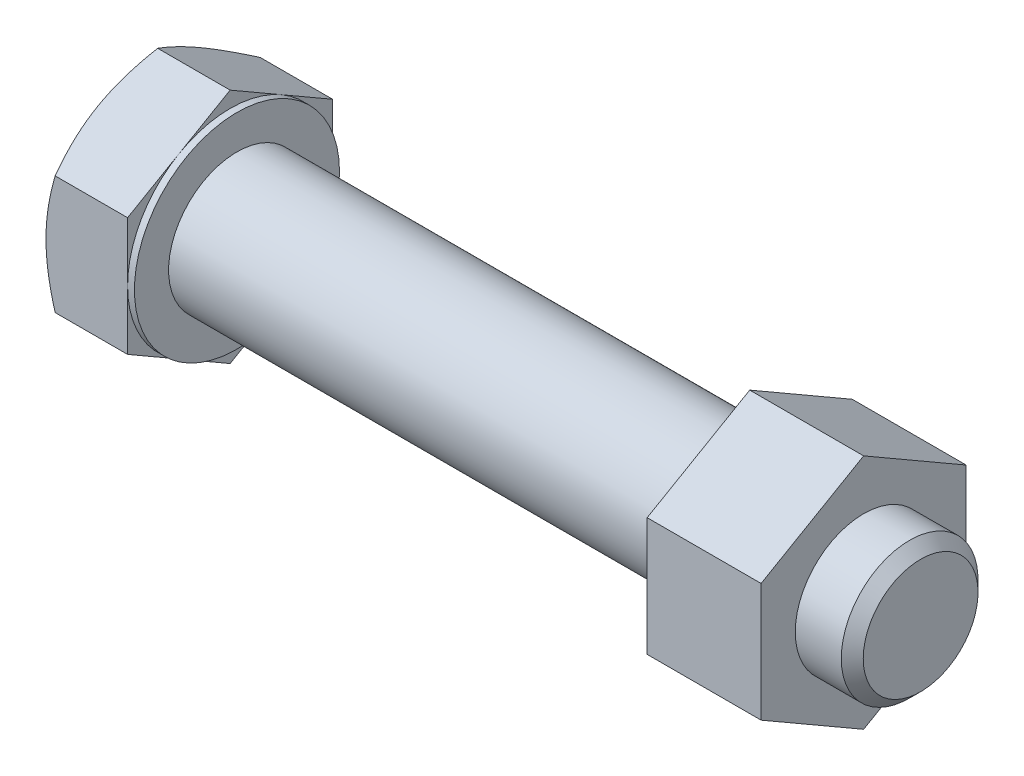
from build123d import *

# Parameters (mm, degrees)
BASEHEAD_DEPTH      = 7.76
SKETCH4_W           = 0.6
SKETCH4_H           = 11.392304845
BOSS_EXTRUDE1_DEPTH = 10


# Read off the part's stored shape, not the designer's step: HeadChamfer
with BuildPart() as part:
    # Sketch1 → BaseHead (new body)
    with BuildSketch(Plane(origin=(0, 0, 0), x_dir=(0, 0, -1), z_dir=(1, 0, 0))):
        Polygon((9, 5.196152423), (9, -5.196152423), (0, -10.392304845), (-9, -5.196152423), (-9, 5.196152423), (0, 10.392304845), align=None)
    extrude(amount=BASEHEAD_DEPTH)

    # HeadChamfer outline → HeadChamfer (revolve, cut)
    with BuildSketch(Plane.YX):
        Polygon((10.392304847, 0.803847578), (9, 0), (10.392304847, 0), align=None)
    revolve(axis=Axis((0, 0, 0), (1, 0, 0)), mode=Mode.SUBTRACT)

    # HeadChamfer 2 outline → HeadChamfer 2 (revolve)
    with BuildSketch(Plane.YX):
        Polygon((6, 7.76), (6, 66.796), (5.036, 67.76), (0, 67.76), (0, 7.76), align=None)
    revolve(axis=Axis((0, 0, 0), (1, 0, 0)))

    # Sketch4 → BearingFace (revolve, cut)
    with BuildSketch(Plane.XY, mode=Mode.PRIVATE) as bearingface_sk:
        with Locations((7.46, 14.696152423)):
            Rectangle(SKETCH4_W, SKETCH4_H)
    revolve(bearingface_sk.sketch.rotate(Axis((0, 0, 0), (1, 0, 0)), 90), axis=Axis((0, 0, 0), (1, 0, 0)), mode=Mode.SUBTRACT)

    # Sketch5 → Boss-Extrude1 (add)
    with BuildSketch(Plane(origin=(62.76, 0, 0), x_dir=(0, 0, -1), z_dir=(1, 0, 0))):
        Polygon((0, 10.392304845), (-9, 5.196152423), (-9, -5.196152423), (0, -10.392304845), (9, -5.196152423), (9, 5.196152423), align=None)
    extrude(amount=-BOSS_EXTRUDE1_DEPTH)


solid = part.part
